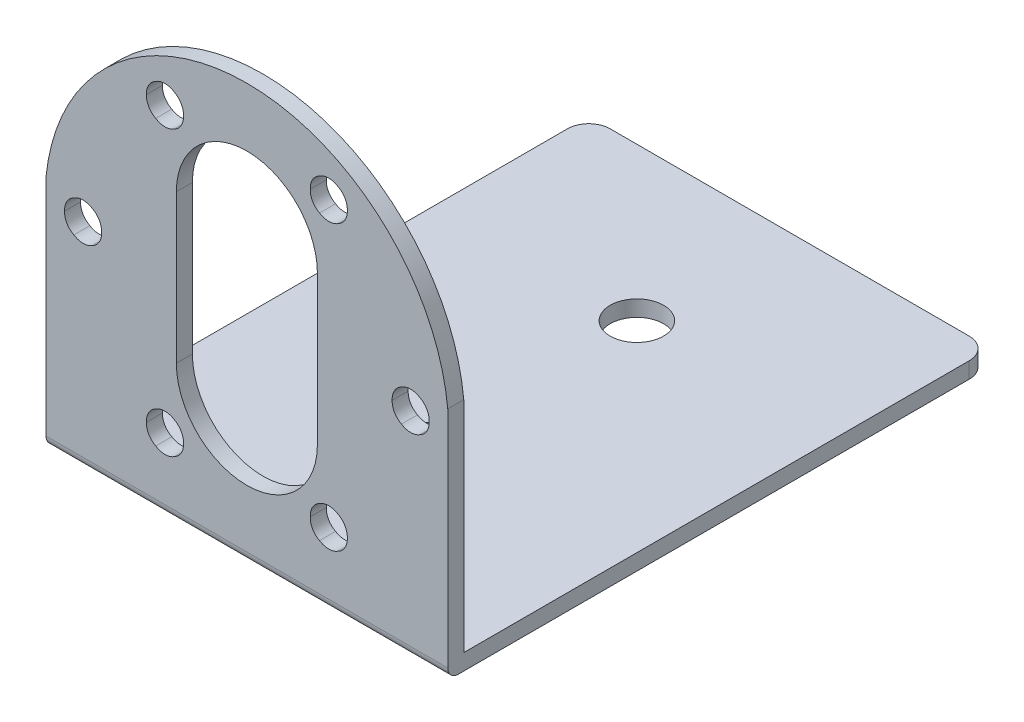
from build123d import *

# Parameters (mm, degrees)
BOSS_EXTRUDE1_DEPTH        = 1.5
SKETCH2_W                  = 37.6
SKETCH2_H                  = 50.8
BOSS_EXTRUDE2_DEPTH        = 1.5
FILLET1_R                  = 1
FILLET2_R                  = 2
CUT_EXTRUDE2_REACH         = 68.746
SKETCH4_R                  = 1.6
CIRPATTERN1_COUNT          = 6
SZKIC1_R                   = 2.5
WYTNIJ_WYCI_GNI_CIE1_DEPTH = 10


with BuildPart() as part:
    # Sketch1 → Boss-Extrude1 (new body)
    with BuildSketch(Plane.XY):
        with BuildLine():
            Line((-18.8, 0), (18.8, 0))
            Line((18.8, 0), (18.8, 22))
            ThreePointArc((18.8, 22), (0, 39), (-18.8, 22))
            Line((-18.8, 22), (-18.8, 0))
        make_face()
        with BuildLine():
            Line((-6.6, 12.999434154), (-6.6, 26.899434154))
            ThreePointArc((-6.6, 26.899434154), (0, 33.5), (6.6, 26.899434154))
            Line((6.6, 26.899434154), (6.6, 12.999434154))
            ThreePointArc((6.6, 12.999434154), (0, 6.399999946), (-6.6, 12.999434154))
        make_face(mode=Mode.SUBTRACT)
    extrude(amount=BOSS_EXTRUDE1_DEPTH)

    # Sketch2 → Boss-Extrude2 (add)
    with BuildSketch(Plane.XZ):
        with Locations((0, -23.9)):
            Rectangle(SKETCH2_W, SKETCH2_H)
    extrude(amount=-BOSS_EXTRUDE2_DEPTH)

    # Fillet1
    fillet1_edges = [part.edges().sort_by_distance(p)[0] for p in [
        (0, 0, 1.5),
    ]]
    fillet(fillet1_edges, radius=FILLET1_R)

    # Fillet2
    fillet2_edges = [part.edges().sort_by_distance(p)[0] for p in [
        (-18.8, 0.75, -49.3),
        (18.8, 0.75, -49.3),
    ]]
    fillet(fillet2_edges, radius=FILLET2_R)

    # Sketch4 → Cut-Extrude2 (cut, up to next)
    with BuildSketch(Plane.XY.offset(1.5), mode=Mode.PRIVATE) as cut_extrude2_sk1:
        with Locations((7.664771385, 33.22577344)):
            Circle(SKETCH4_R)
    cut_extrude2_tool1 = extrude(cut_extrude2_sk1.sketch, amount=-CUT_EXTRUDE2_REACH, mode=Mode.PRIVATE) & part.part
    # Sketch4 → Cut-Extrude2 (cut, up to next)
    with BuildSketch(Plane.XY.offset(1.5), mode=Mode.PRIVATE) as cut_extrude2_sk2:
        with Locations((15.32954277, 19.949999973)):
            Circle(SKETCH4_R)
    cut_extrude2_tool2 = extrude(cut_extrude2_sk2.sketch, amount=-CUT_EXTRUDE2_REACH, mode=Mode.PRIVATE) & part.part
    # Sketch4 → Cut-Extrude2 (cut, up to next)
    with BuildSketch(Plane.XY.offset(1.5), mode=Mode.PRIVATE) as cut_extrude2_sk3:
        with Locations((7.664771385, 6.674226506)):
            Circle(SKETCH4_R)
    cut_extrude2_tool3 = extrude(cut_extrude2_sk3.sketch, amount=-CUT_EXTRUDE2_REACH, mode=Mode.PRIVATE) & part.part
    # Sketch4 → Cut-Extrude2 (cut, up to next)
    with BuildSketch(Plane.XY.offset(1.5), mode=Mode.PRIVATE) as cut_extrude2_sk4:
        with Locations((-7.664771385, 6.674226506)):
            Circle(SKETCH4_R)
    cut_extrude2_tool4 = extrude(cut_extrude2_sk4.sketch, amount=-CUT_EXTRUDE2_REACH, mode=Mode.PRIVATE) & part.part
    # Sketch4 → Cut-Extrude2 (cut, up to next)
    with BuildSketch(Plane.XY.offset(1.5), mode=Mode.PRIVATE) as cut_extrude2_sk5:
        with Locations((-15.32954277, 19.949999973)):
            Circle(SKETCH4_R)
    cut_extrude2_tool5 = extrude(cut_extrude2_sk5.sketch, amount=-CUT_EXTRUDE2_REACH, mode=Mode.PRIVATE) & part.part
    # Sketch4 → Cut-Extrude2 (cut, up to next)
    with BuildSketch(Plane.XY.offset(1.5), mode=Mode.PRIVATE) as cut_extrude2_sk6:
        with Locations((-7.664771385, 33.22577344)):
            Circle(SKETCH4_R)
    cut_extrude2_tool6 = extrude(cut_extrude2_sk6.sketch, amount=-CUT_EXTRUDE2_REACH, mode=Mode.PRIVATE) & part.part
    cut_extrude2_1 = cut_extrude2_tool1.solids().sort_by_distance((7.664771, 33.225773, 1.5))[0]
    add(cut_extrude2_1, mode=Mode.SUBTRACT)
    cut_extrude2_2 = cut_extrude2_tool2.solids().sort_by_distance((15.329543, 19.95, 1.5))[0]
    add(cut_extrude2_2, mode=Mode.SUBTRACT)
    cut_extrude2_3 = cut_extrude2_tool3.solids().sort_by_distance((7.664771, 6.674227, 1.5))[0]
    add(cut_extrude2_3, mode=Mode.SUBTRACT)
    cut_extrude2_4 = cut_extrude2_tool4.solids().sort_by_distance((-7.664771, 6.674227, 1.5))[0]
    add(cut_extrude2_4, mode=Mode.SUBTRACT)
    cut_extrude2_5 = cut_extrude2_tool5.solids().sort_by_distance((-15.329543, 19.95, 1.5))[0]
    add(cut_extrude2_5, mode=Mode.SUBTRACT)
    cut_extrude2_6 = cut_extrude2_tool6.solids().sort_by_distance((-7.664771, 33.225773, 1.5))[0]
    add(cut_extrude2_6, mode=Mode.SUBTRACT)
    cut_extrude2 = cut_extrude2_1 + cut_extrude2_2 + cut_extrude2_3 + cut_extrude2_4 + cut_extrude2_5 + cut_extrude2_6  # Cut-Extrude2 as one shape, for the pattern or mirror that repeats it

    # CirPattern1: Cut-Extrude2 ×6 about axis
    cirpattern1_axis = Axis((0, 20.104705882, 1.5), (0, 0, -1))
    for i in range(1, CIRPATTERN1_COUNT):
        add(cut_extrude2.rotate(cirpattern1_axis, i * 360 / CIRPATTERN1_COUNT), mode=Mode.SUBTRACT)

    # Szkic1 → Wytnij-wyciągnięcie1 (cut)
    with BuildSketch(Plane(origin=(0, 1.5, 0), x_dir=(1, 0, 0), z_dir=(0, 1, 0))):
        with Locations((0, 15)):
            Circle(SZKIC1_R)
        with Locations((0, 35)):
            Circle(SZKIC1_R)
    extrude(amount=-WYTNIJ_WYCI_GNI_CIE1_DEPTH, mode=Mode.SUBTRACT)


solid = part.part
